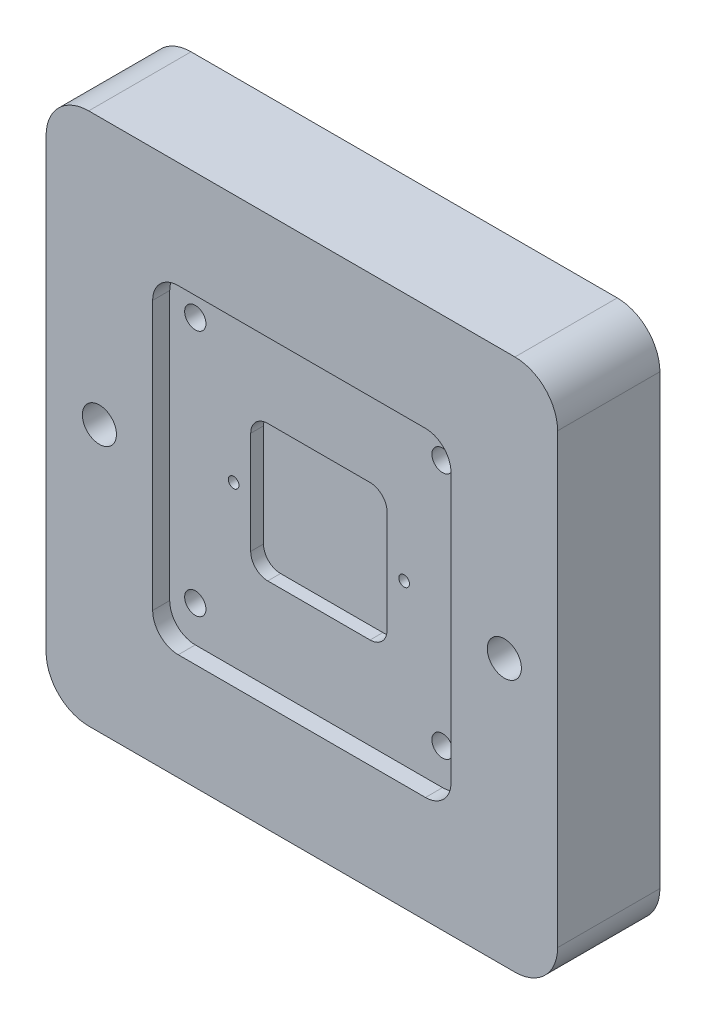
from build123d import *

# Parameters (mm, degrees)
BOSS_EXTRUDE1_DEPTH             = 4
BOSS_EXTRUDE2_DEPTH             = 20
F_8_0MM_DOWEL_HOLE1_D           = 8
F_8_0MM_DOWEL_HOLE1_DEPTH       = 18
F_8_0MM_DOWEL_HOLE1_TIP         = 2.403442476
TAP_DRILL_FOR_M6X1_0_TAP1_D     = 5
TAP_DRILL_FOR_M6X1_0_TAP1_DEPTH = 10
TAP_DRILL_FOR_M6X1_0_TAP1_TIP   = 1.502151548
CUT_EXTRUDE4_DEPTH              = 3
TAP_DRILL_FOR_M3_TAP1_D         = 2.5
TAP_DRILL_FOR_M3_TAP1_DEPTH     = 18
TAP_DRILL_FOR_M3_TAP1_TIP       = 0.751075774


with BuildPart() as part:
    # Sketch1 → Boss-Extrude1 (new body)
    with BuildSketch(Plane.XY):
        with BuildLine():
            Line((-50, 62.5), (50, 62.5))
            ThreePointArc((50, 62.5), (57.071067812, 59.571067812), (60, 52.5))
            Line((60, 52.5), (60, -52.5))
            ThreePointArc((60, -52.5), (57.071067812, -59.571067812), (50, -62.5))
            Line((50, -62.5), (-50, -62.5))
            ThreePointArc((-50, -62.5), (-57.071067812, -59.571067812), (-60, -52.5))
            Line((-60, -52.5), (-60, 52.5))
            ThreePointArc((-60, 52.5), (-57.071067812, 59.571067812), (-50, 62.5))
        make_face()
        with BuildLine():
            Line((-29, 37.5), (29, 37.5))
            ThreePointArc((29, 37.5), (33.242640687, 35.742640687), (35, 31.5))
            Line((35, 31.5), (35, -31.5))
            ThreePointArc((35, -31.5), (33.242640687, -35.742640687), (29, -37.5))
            Line((29, -37.5), (-29, -37.5))
            ThreePointArc((-29, -37.5), (-33.242640687, -35.742640687), (-35, -31.5))
            Line((-35, -31.5), (-35, 31.5))
            ThreePointArc((-35, 31.5), (-33.242640687, 35.742640687), (-29, 37.5))
        make_face(mode=Mode.SUBTRACT)
    extrude(amount=-BOSS_EXTRUDE1_DEPTH)

    # Sketch2 → Boss-Extrude2 (add)
    with BuildSketch(Plane.XY.offset(-4)):
        with BuildLine():
            Line((-50, -62.5), (50, -62.5))
            ThreePointArc((50, -62.5), (57.071067812, -59.571067812), (60, -52.5))
            Line((60, -52.5), (60, 52.5))
            ThreePointArc((60, 52.5), (57.071067812, 59.571067812), (50, 62.5))
            Line((50, 62.5), (-50, 62.5))
            ThreePointArc((-50, 62.5), (-57.071067812, 59.571067812), (-60, 52.5))
            Line((-60, 52.5), (-60, -52.5))
            ThreePointArc((-60, -52.5), (-57.071067812, -59.571067812), (-50, -62.5))
        make_face()
    extrude(amount=-BOSS_EXTRUDE2_DEPTH)

    # Ø8.0mm Dowel Hole1
    with Locations(Plane.XY):
        with Locations((-47.5, 0), (47.5, 0)):
            Hole(F_8_0MM_DOWEL_HOLE1_D / 2, depth=F_8_0MM_DOWEL_HOLE1_DEPTH)
            with Locations((0, 0, -(F_8_0MM_DOWEL_HOLE1_DEPTH + F_8_0MM_DOWEL_HOLE1_TIP / 2))):  # 118° drill point
                Cone(0, F_8_0MM_DOWEL_HOLE1_D / 2, F_8_0MM_DOWEL_HOLE1_TIP, mode=Mode.SUBTRACT)

    # Tap Drill for M6x1.0 Tap1
    with Locations(Plane.XY.offset(-4)):
        with Locations((-29, 29), (29, 29), (29, -29), (-29, -29)):
            Hole(TAP_DRILL_FOR_M6X1_0_TAP1_D / 2, depth=TAP_DRILL_FOR_M6X1_0_TAP1_DEPTH)
            with Locations((0, 0, -(TAP_DRILL_FOR_M6X1_0_TAP1_DEPTH + TAP_DRILL_FOR_M6X1_0_TAP1_TIP / 2))):  # 118° drill point
                Cone(0, TAP_DRILL_FOR_M6X1_0_TAP1_D / 2, TAP_DRILL_FOR_M6X1_0_TAP1_TIP, mode=Mode.SUBTRACT)

    # Sketch11 → Cut-Extrude4 (cut)
    with BuildSketch(Plane.XY.offset(-4)):
        with BuildLine():
            Line((-12, 16), (12, 16))
            ThreePointArc((12, 16), (14.828427125, 14.828427125), (16, 12))
            Line((16, 12), (16, -12))
            ThreePointArc((16, -12), (14.828427125, -14.828427125), (12, -16))
            Line((12, -16), (-12, -16))
            ThreePointArc((-12, -16), (-14.828427125, -14.828427125), (-16, -12))
            Line((-16, -12), (-16, 12))
            ThreePointArc((-16, 12), (-14.828427125, 14.828427125), (-12, 16))
        make_face()
    extrude(amount=-CUT_EXTRUDE4_DEPTH, mode=Mode.SUBTRACT)

    # Tap Drill for M3 Tap1
    with Locations(Plane.XY.offset(-4)):
        with Locations((-20, 0), (20, 0)):
            Hole(TAP_DRILL_FOR_M3_TAP1_D / 2, depth=TAP_DRILL_FOR_M3_TAP1_DEPTH)
            with Locations((0, 0, -(TAP_DRILL_FOR_M3_TAP1_DEPTH + TAP_DRILL_FOR_M3_TAP1_TIP / 2))):  # 118° drill point
                Cone(0, TAP_DRILL_FOR_M3_TAP1_D / 2, TAP_DRILL_FOR_M3_TAP1_TIP, mode=Mode.SUBTRACT)


solid = part.part
